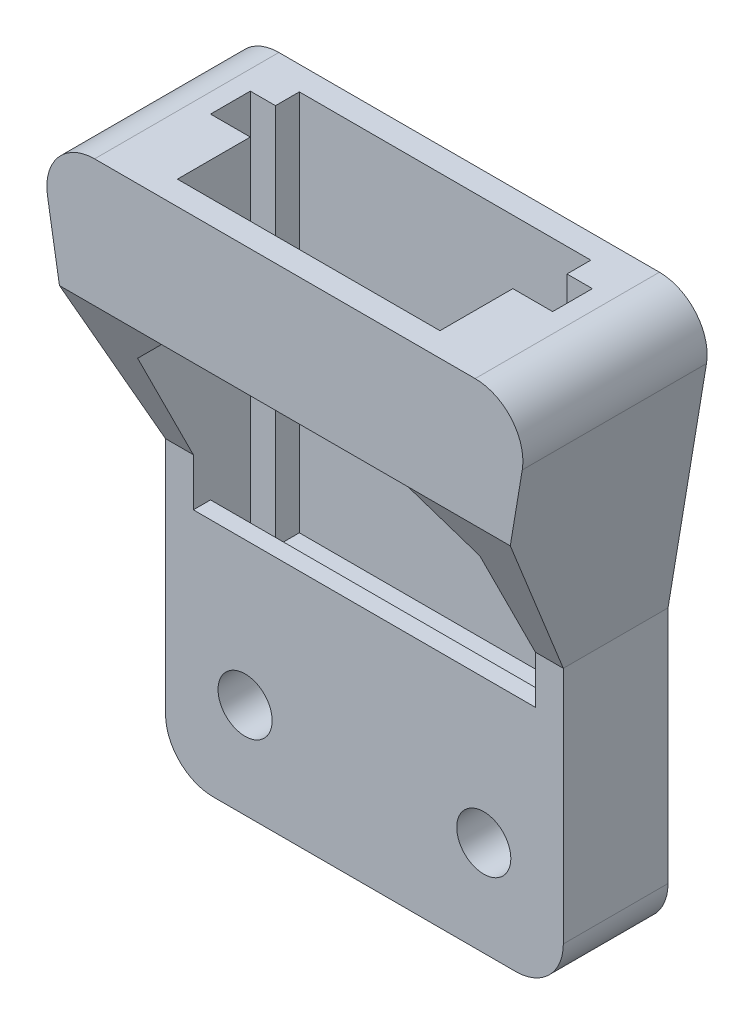
from build123d import *
from OCP.BRepFilletAPI import BRepFilletAPI_MakeChamfer

# Parameters (mm, degrees)
ESQUISSE2_W             = 25
ESQUISSE2_H             = 36
BOSS_EXTRU_1_DEPTH      = 1.5
ESQUISSE3_W             = 3.350614404
ESQUISSE3_H             = 24
ESQUISSE3_W_2           = 3.329385596
BOSS_EXTRU_2_DEPTH      = 1.5
BOSS_EXTRU_3_DEPTH      = 8.58
BOSS_EXTRU_3_DEPTH_BACK = 3
BOSS_EXTRU_4_START      = 2.5
ESQUISSE5_W             = 18.32
ESQUISSE5_H             = 3
BOSS_EXTRU_4_DEPTH      = 6.08
ESQUISSE6_W             = 16.5
ESQUISSE6_H             = 1.5
BOSS_EXTRU_5_DEPTH      = 8
ESQUISSE7_W             = 25
ESQUISSE7_H             = 18
ENL_V_MAT_EXTRU_1_DEPTH = 5
CHANFREIN1_SIZE         = 10
CHANFREIN1_SIZE_2       = 5
CHANFREIN3_SIZE         = 3
CONG_1_R                = 3
CONG_2_R                = 3
D_GAGEMENT_M31_D        = 3.4


# Some blends are built 0.0001 mm under size
with BuildPart() as part:
    # Esquisse2 → Boss.-Extru.1 (new body)
    with BuildSketch(Plane.XY):
        with Locations((0, -137)):
            Rectangle(ESQUISSE2_W, ESQUISSE2_H)
    extrude(amount=BOSS_EXTRU_1_DEPTH)

    # Esquisse3 → Boss.-Extru.2 (add)
    with BuildSketch(Plane.XY.offset(1.5)):
        with Locations((10.824692798, -131)):
            Rectangle(ESQUISSE3_W, ESQUISSE3_H)
        Polygon((-12.5, -143), (-12.5, -155), (12.5, -155), (12.5, -143), (9.149385596, -143), (-9.170614404, -143), align=None)
        with Locations((-10.835307202, -131)):
            Rectangle(ESQUISSE3_W_2, ESQUISSE3_H)
    extrude(amount=BOSS_EXTRU_2_DEPTH)

    # Esquisse4 → Boss.-Extru.3 (add, two sides: drawn at the far end of the back side and taken through both)
    with BuildSketch(Plane.XY.offset(3).offset(-BOSS_EXTRU_3_DEPTH_BACK)):
        Polygon((-12.5, -119), (-15.5, -119), (-12.5, -137), (-12.5, -155), (12.5, -155), (12.5, -137), (15.5, -119), (12.5, -119), (10.747346399, -119), (10.747346399, -146), (-10.752653601, -146), (-10.752653601, -119), align=None)
    extrude(amount=BOSS_EXTRU_3_DEPTH + BOSS_EXTRU_3_DEPTH_BACK)

    # Esquisse5 → Boss.-Extru.4 (add)
    with BuildSketch(Plane.XY.offset(3).offset(BOSS_EXTRU_4_START)):
        Polygon((-10.752653601, -140), (-10.752653601, -146), (10.747346399, -146), (10.747346399, -140), (9.149385596, -140), (9.149385596, -143), (-9.170614404, -143), (-9.170614404, -140), align=None)
        with Locations((-0.010614404, -141.5)):
            Rectangle(ESQUISSE5_W, ESQUISSE5_H)
    extrude(amount=BOSS_EXTRU_4_DEPTH)

    # Esquisse6 → Boss.-Extru.5 (add)
    with BuildSketch(Plane(origin=(0, -119, 0), x_dir=(1, 0, 0), z_dir=(0, 1, 0))):
        Polygon((8.247346399, -11.58), (10.747346399, -11.58), (10.747346399, -5.5), (8.247346399, -5.5), (8.247346399, -10.08), align=None)
        with Locations((-0.002653601, -10.83)):
            Rectangle(ESQUISSE6_W, ESQUISSE6_H)
        Polygon((-10.752653601, -11.58), (-8.252653601, -11.58), (-8.252653601, -10.08), (-8.252653601, -5.5), (-10.752653601, -5.5), align=None)
    extrude(amount=-BOSS_EXTRU_5_DEPTH)

    # Esquisse7 → Enlèv. mat.-Extru.1 (cut)
    with BuildSketch(Plane.XY.offset(11.58)):
        with Locations((0, -146)):
            Rectangle(ESQUISSE7_W, ESQUISSE7_H)
    extrude(amount=-ENL_V_MAT_EXTRU_1_DEPTH, mode=Mode.SUBTRACT)

    # Chanfrein1
    chanfrein1_edges_1 = [part.edges().sort_by_distance(p)[0] for p in [
        (11.6236732, -137, 11.58),
    ]]
    chanfrein1_side_1 = [part.faces().sort_by_distance(p)[0] for p in [
        (11.6236732, -136.9, 11.58),
    ]]
    chanfrein1_edges_2 = [part.edges().sort_by_distance(p)[0] for p in [
        (-11.6263268, -137, 11.58),
    ]]
    chanfrein1_side_2 = [part.faces().sort_by_distance(p)[0] for p in [
        (-11.6263268, -136.9, 11.58),
    ]]
    chanfrein1 = BRepFilletAPI_MakeChamfer(part.part.solid().wrapped)
    for e in chanfrein1_edges_1:
        chanfrein1.Add(CHANFREIN1_SIZE - 0.0001, CHANFREIN1_SIZE_2 - 0.0001, e.wrapped, chanfrein1_side_1[0].wrapped)
    for e in chanfrein1_edges_2:
        chanfrein1.Add(CHANFREIN1_SIZE - 0.0001, CHANFREIN1_SIZE_2 - 0.0001, e.wrapped, chanfrein1_side_2[0].wrapped)
    add(Compound.cast(chanfrein1.Shape()), mode=Mode.REPLACE)  # a hair under: the kernel refuses the full size

    # Chanfrein3
    # the kernel refuses this chamfer: 3 mm, written as the material it adds along each edge
    with BuildSketch(Plane(origin=(-10.752653601, -127, 5.5), x_dir=(0.9996219169112968, 0.027495876610586775, 0), z_dir=(0, 0, 1))) as chanfrein3_piece_1_section:
        Polygon((CHANFREIN3_SIZE * 0.999621916911, -CHANFREIN3_SIZE * 0.0274958766106), (-CHANFREIN3_SIZE * 0.0274958766106, -CHANFREIN3_SIZE * 0.999621916911), (0, 0), align=None)
    chanfrein3_piece_1 = extrude(amount=6.08, mode=Mode.PRIVATE)
    chanfrein3_piece_1 = split(chanfrein3_piece_1, bisect_by=Plane(origin=(-8.784858651, -128.928894575, 10.615612357), z_dir=(0, 0.4472100177446834, -0.8944289798686087)), keep=Keep.TOP, mode=Mode.PRIVATE)
    chanfrein3_piece_1 = split(chanfrein3_piece_1, bisect_by=Plane(origin=(-8.252653601, -127.516102525, 7.79), z_dir=(-1, 0, 0)), keep=Keep.TOP, mode=Mode.PRIVATE)
    add(chanfrein3_piece_1)
    with BuildSketch(Plane(origin=(-10.752653601, -127, -2.215048964), x_dir=(0.9996219169112968, 0.027495876610586775, 0), z_dir=(0, 0, 1))) as chanfrein3_piece_2_section:
        Polygon((CHANFREIN3_SIZE * 0.999621916911, -CHANFREIN3_SIZE * 0.0274958766106), (-CHANFREIN3_SIZE * 0.0274958766106, -CHANFREIN3_SIZE * 0.999621916911), (0, 0), align=None)
    chanfrein3_piece_2 = extrude(amount=13.795048964, mode=Mode.PRIVATE)
    chanfrein3_piece_2 = split(chanfrein3_piece_2, bisect_by=Plane(origin=(-8.083536067, -127.445596899, 11.357253778), z_dir=(0, 0.4472100177446834, -0.8944289798686087)), keep=Keep.TOP, mode=Mode.PRIVATE)
    chanfrein3_piece_2 = split(chanfrein3_piece_2, bisect_by=Plane(origin=(-8.083536067, -127.161764932, 10.08), z_dir=(0, 0, 1)), keep=Keep.TOP, mode=Mode.PRIVATE)
    add(chanfrein3_piece_2)
    with BuildSketch(Plane(origin=(10.747346399, -127, 11.58), x_dir=(0.027495876610588044, -0.9996219169112968, 0), z_dir=(0, 0, -1))) as chanfrein3_piece_3_section:
        Polygon((CHANFREIN3_SIZE * 0.999621916911, CHANFREIN3_SIZE * 0.0274958766106), (-CHANFREIN3_SIZE * 0.0274958766106, CHANFREIN3_SIZE * 0.999621916911), (0, 0), align=None)
    chanfrein3_piece_3 = extrude(amount=6.08, mode=Mode.PRIVATE)
    chanfrein3_piece_3 = split(chanfrein3_piece_3, bisect_by=Plane(origin=(9.990097255, -128.087123339, 11.036493766), z_dir=(0, 0.4472100177446834, -0.8944289798686087)), keep=Keep.TOP, mode=Mode.PRIVATE)
    chanfrein3_piece_3 = split(chanfrein3_piece_3, bisect_by=Plane(origin=(8.247346399, -127.874570821, 10.61138448), z_dir=(1, 0, 0)), keep=Keep.TOP, mode=Mode.PRIVATE)
    add(chanfrein3_piece_3)
    with BuildSketch(Plane(origin=(10.747346399, -127, 11.58), x_dir=(0.027495876610588044, -0.9996219169112968, 0), z_dir=(0, 0, -1))) as chanfrein3_piece_4_section:
        Polygon((CHANFREIN3_SIZE * 0.999621916911, CHANFREIN3_SIZE * 0.0274958766106), (-CHANFREIN3_SIZE * 0.0274958766106, CHANFREIN3_SIZE * 0.999621916911), (0, 0), align=None)
    chanfrein3_piece_4 = extrude(amount=13.795048964, mode=Mode.PRIVATE)
    chanfrein3_piece_4 = split(chanfrein3_piece_4, bisect_by=Plane(origin=(8.078228865, -127.445596899, 11.357253778), z_dir=(0, 0.4472100177446834, -0.8944289798686087)), keep=Keep.TOP, mode=Mode.PRIVATE)
    chanfrein3_piece_4 = split(chanfrein3_piece_4, bisect_by=Plane(origin=(8.078228865, -127.161764932, 10.08), z_dir=(0, 0, 1)), keep=Keep.TOP, mode=Mode.PRIVATE)
    add(chanfrein3_piece_4)

    # Congé1
    cong_1_edges = [part.edges().sort_by_distance(p)[0] for p in [
        (-15.5, -119, 5.79),
        (15.5, -119, 5.79),
    ]]
    fillet(cong_1_edges, radius=CONG_1_R)

    # Congé2
    cong_2_edges = [part.edges().sort_by_distance(p)[0] for p in [
        (12.5, -155, 3.29),
        (-12.5, -155, 3.29),
    ]]
    fillet(cong_2_edges, radius=CONG_2_R)

    # Dégagement M31 (through all)
    with Locations(Plane.XY.offset(6.58)):
        with Locations((7.5, -149), (-7.5, -149)):
            Hole(D_GAGEMENT_M31_D / 2)


solid = part.part
